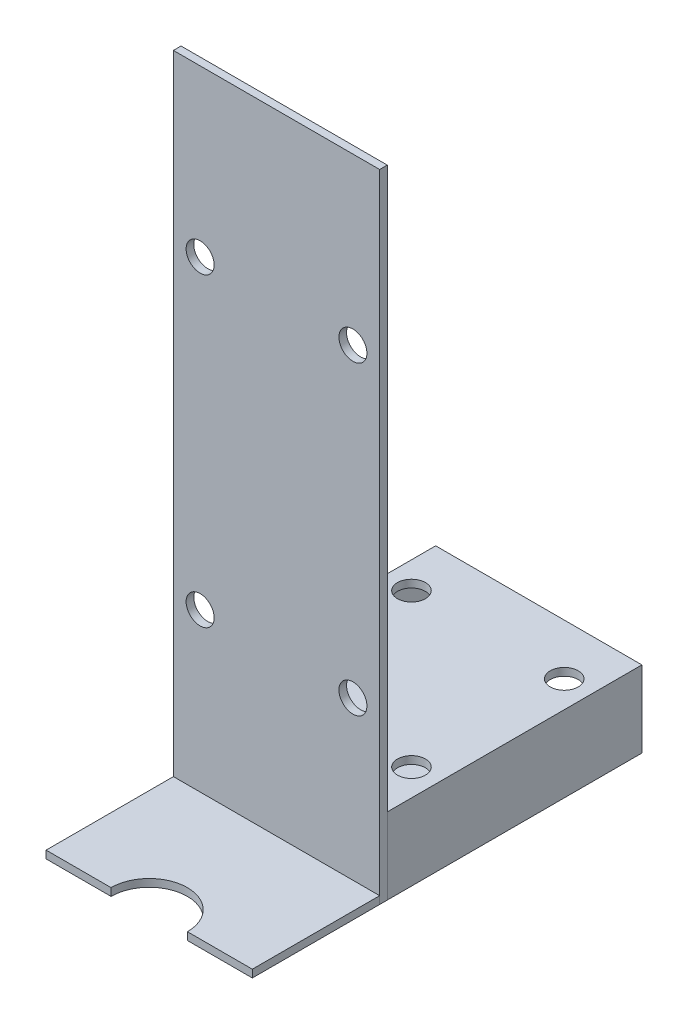
from build123d import *

# Parameters (mm, degrees)
SKETCH2_W                       = 40.5
SKETCH2_H                       = 15
SKETCH2_W_2                     = 37.5
SKETCH2_H_2                     = 12
TUBE_CANTILEVER_DEPTH           = 50
SKETCH4_W                       = 40.5
SKETCH4_H                       = 1.5
FLANGE_LEG_DEPTH                = 125
SKETCH5_W                       = 40.5
SKETCH5_H                       = 1.5
BOTTOM_LEG_DEPTH                = 25
SKETCH6_R                       = 7.5
LEADSCREW_CLEARANCE_DEPTH       = 25
SKETCH8_W                       = 2.75
SKETCH8_H                       = 15
DESKTOP_HOLE_PATTERN_AT_2_COUNT = 2
DESKTOP_HOLE_PATTERN_AT_2_PITCH = 42.426406871
DESKTOP_HOLE_PATTERN_AT_3_COUNT = 2
DESKTOP_HOLE_PATTERN_AT_3_PITCH = 30
DESKTOP_HOLE_PATTERN_AT_4_COUNT = 2
DESKTOP_HOLE_PATTERN_AT_4_PITCH = 30
SKETCH10_W                      = 2.75
SKETCH10_H                      = 26.5
BEARING_HOLE_PATTERN_AT_2_COUNT = 2
BEARING_HOLE_PATTERN_AT_2_PITCH = 67.082039325
BEARING_HOLE_PATTERN_AT_3_COUNT = 2
BEARING_HOLE_PATTERN_AT_3_PITCH = 60
BEARING_HOLE_PATTERN_AT_4_COUNT = 2
BEARING_HOLE_PATTERN_AT_4_PITCH = 30


with BuildPart() as part:
    # Sketch2 → tube cantilever (new body)
    with BuildSketch(Plane.XY):
        with Locations((18.75, 6)):
            Rectangle(SKETCH2_W, SKETCH2_H)
        with Locations((18.75, 6)):
            Rectangle(SKETCH2_W_2, SKETCH2_H_2, mode=Mode.SUBTRACT)
    extrude(amount=TUBE_CANTILEVER_DEPTH)

    # Sketch8 → desktop hole pattern (revolve, cut)
    with BuildSketch(Plane(origin=(3.75, 13.5, 10), x_dir=(0, 0, 1), z_dir=(1, 0, 0))):
        with Locations((1.375, 7.5)):
            Rectangle(SKETCH8_W, SKETCH8_H)
    desktop_hole_pattern = revolve(axis=Axis((3.75, 19.85, 10), (0, -1, 0)), mode=Mode.SUBTRACT)

    # desktop hole pattern at 2: desktop hole pattern ×2
    with Locations(*[Vector(0.7071067811865475, 0, 0.7071067811865477) * (i * DESKTOP_HOLE_PATTERN_AT_2_PITCH) for i in range(1, DESKTOP_HOLE_PATTERN_AT_2_COUNT)]):
        add(desktop_hole_pattern, mode=Mode.SUBTRACT)

    # desktop hole pattern at 3: desktop hole pattern ×2
    with Locations(*[(0, 0, i * DESKTOP_HOLE_PATTERN_AT_3_PITCH) for i in range(1, DESKTOP_HOLE_PATTERN_AT_3_COUNT)]):
        add(desktop_hole_pattern, mode=Mode.SUBTRACT)

    # desktop hole pattern at 4: desktop hole pattern ×2
    with Locations(*[(i * DESKTOP_HOLE_PATTERN_AT_4_PITCH, 0, 0) for i in range(1, DESKTOP_HOLE_PATTERN_AT_4_COUNT)]):
        add(desktop_hole_pattern, mode=Mode.SUBTRACT)


with BuildPart() as body_2:
    # Sketch4 → flange leg (new body)
    with BuildSketch(Plane(origin=(0, -1.5, 0), x_dir=(1, 0, 0), z_dir=(0, 1, 0))):
        with Locations((18.75, -50.75)):
            Rectangle(SKETCH4_W, SKETCH4_H)
    extrude(amount=FLANGE_LEG_DEPTH)

    # Sketch10 → bearing hole pattern (revolve, cut)
    with BuildSketch(Plane(origin=(33.75, 91, 50), x_dir=(0, 1, 0), z_dir=(1, 0, 0))):
        with Locations((1.375, 13.25)):
            Rectangle(SKETCH10_W, SKETCH10_H)
    bearing_hole_pattern = revolve(axis=Axis((33.75, 91, 43.65), (0, 0, 1)), mode=Mode.SUBTRACT)

    # bearing hole pattern at 2: bearing hole pattern ×2
    with Locations(*[Vector(-0.447213595499958, -0.894427190999916, 0) * (i * BEARING_HOLE_PATTERN_AT_2_PITCH) for i in range(1, BEARING_HOLE_PATTERN_AT_2_COUNT)]):
        add(bearing_hole_pattern, mode=Mode.SUBTRACT)

    # bearing hole pattern at 3: bearing hole pattern ×2
    with Locations(*[(0, -i * BEARING_HOLE_PATTERN_AT_3_PITCH, 0) for i in range(1, BEARING_HOLE_PATTERN_AT_3_COUNT)]):
        add(bearing_hole_pattern, mode=Mode.SUBTRACT)

    # bearing hole pattern at 4: bearing hole pattern ×2
    with Locations(*[(-i * BEARING_HOLE_PATTERN_AT_4_PITCH, 0, 0) for i in range(1, BEARING_HOLE_PATTERN_AT_4_COUNT)]):
        add(bearing_hole_pattern, mode=Mode.SUBTRACT)


with BuildPart() as body_3:
    # Sketch5 → bottom leg (new body)
    with BuildSketch(Plane.XY.offset(51.5)):
        with Locations((18.75, -0.75)):
            Rectangle(SKETCH5_W, SKETCH5_H)
    extrude(amount=BOTTOM_LEG_DEPTH)

    # Sketch6 → leadscrew clearance (cut)
    with BuildSketch(Plane.XZ.offset(1.5)):
        with Locations((18.75, 76.5)):
            Circle(SKETCH6_R)
    extrude(amount=-LEADSCREW_CLEARANCE_DEPTH, mode=Mode.SUBTRACT)


solid = Compound([part.part, body_2.part, body_3.part])
